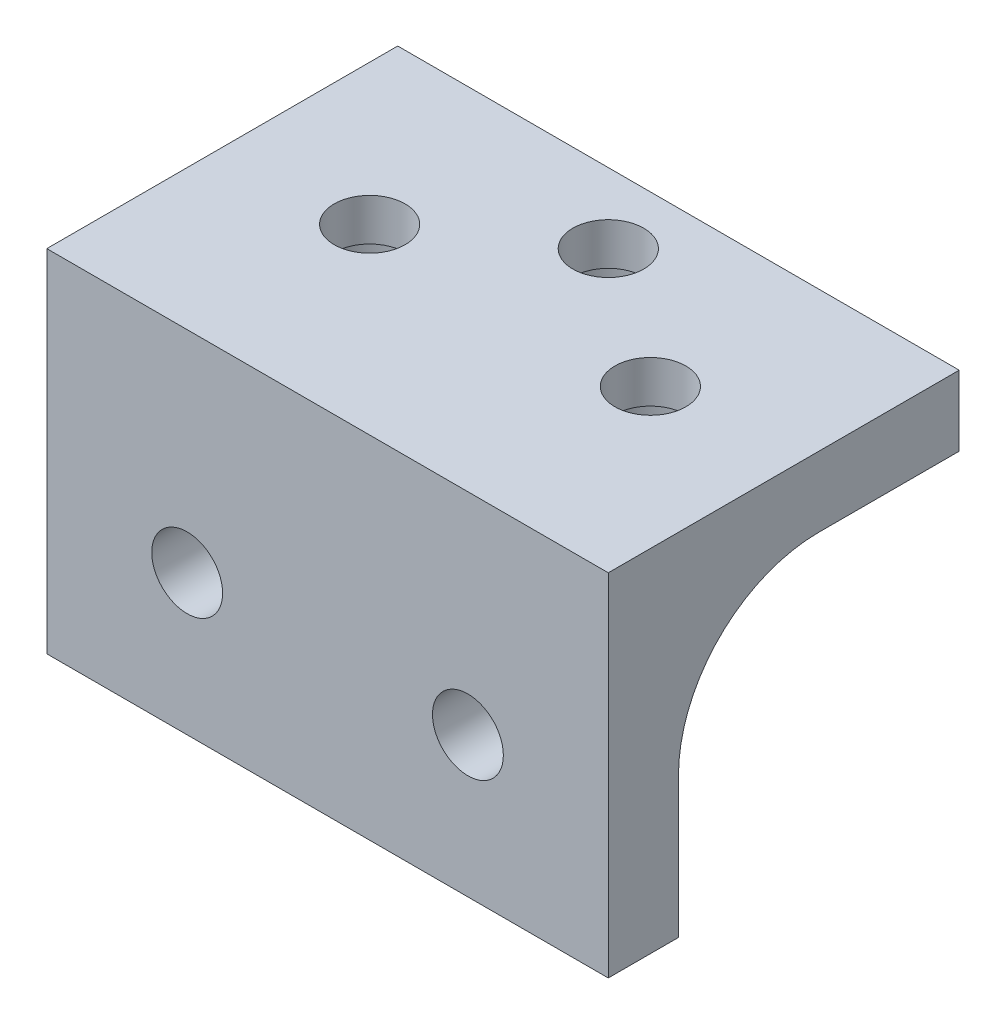
from build123d import *

# Parameters (mm, degrees)
CROQUIS1_W              = 40
CROQUIS1_H              = 20
CROQUIS1_R              = 2.525
CROQUIS1_H_2            = 5
SALIENTE_EXTRUIR1_DEPTH = 5
CROQUIS1_3_W            = 40
CROQUIS1_3_H            = 5
SALIENTE_EXTRUIR2_DEPTH = 20
CROQUIS2_R              = 2.525
CORTAR_EXTRUIR1_DEPTH   = 49.989794856
CROQUIS4_R              = 4.025
CORTAR_EXTRUIR2_DEPTH   = 2
REDONDEO1_R             = 10


with BuildPart() as part:
    # Croquis1 → Saliente-Extruir1 (new body)
    # profile 1 of 2: a face of its own
    with BuildSketch(Plane.XY):
        with Locations((20, 10)):
            Rectangle(CROQUIS1_W, CROQUIS1_H)
        with Locations((10, 10)):
            Circle(CROQUIS1_R, mode=Mode.SUBTRACT)
        with Locations((30, 10)):
            Circle(CROQUIS1_R, mode=Mode.SUBTRACT)
    # profile 2 of 2: a face of its own
    with BuildSketch(Plane.XY):
        with Locations((20, 22.5)):
            Rectangle(CROQUIS1_W, CROQUIS1_H_2)
    extrude(amount=SALIENTE_EXTRUIR1_DEPTH)

    # Croquis1<3> → Saliente-Extruir2 (add)
    with BuildSketch(Plane.XY):
        with Locations((20, 22.5)):
            Rectangle(CROQUIS1_3_W, CROQUIS1_3_H)
    extrude(amount=-SALIENTE_EXTRUIR2_DEPTH)

    # Croquis2 → Cortar-Extruir1 (cut, through all)
    with BuildSketch(Plane.XZ.offset(-20)):
        with Locations(Location((10, -8, 0), (0, 0, 270))):
            Circle(CROQUIS2_R)
        with Locations(Location((30, -8, 0), (0, 0, 270))):
            Circle(CROQUIS2_R)
        with Locations(Location((20, -15, 0), (0, 0, 270))):
            Circle(CROQUIS2_R)
    extrude(amount=-CORTAR_EXTRUIR1_DEPTH, mode=Mode.SUBTRACT)

    # Croquis4 → Cortar-Extruir2 (cut)
    with BuildSketch(Plane.XZ.offset(-20)):
        with Locations(Location((10, -8, 0), (0, 0, 270))):
            Circle(CROQUIS4_R)
        with Locations(Location((20, -15, 0), (0, 0, 270))):
            Circle(CROQUIS4_R)
        with Locations(Location((30, -8, 0), (0, 0, 270))):
            Circle(CROQUIS4_R)
    extrude(amount=-CORTAR_EXTRUIR2_DEPTH, mode=Mode.SUBTRACT)

    # Redondeo1
    # the kernel refuses this fillet: 10 mm, written as the material it adds along each edge
    with BuildSketch(Plane(origin=(0, 20, 0), x_dir=(0, -1, 0), z_dir=(1, 0, 0))) as redondeo1_piece_1_section:
        with BuildLine():
            CenterArc((REDONDEO1_R, REDONDEO1_R), REDONDEO1_R, 180, 90)
            Line((0, REDONDEO1_R), (0, 0))
            Line((0, 0), (REDONDEO1_R, 0))
        make_face()
    redondeo1_piece_1 = extrude(amount=40, mode=Mode.PRIVATE)
    redondeo1_piece_1 = redondeo1_piece_1 - Plane(origin=(10, 10, -2.034462618), x_dir=(1, 0, 0), z_dir=(0, 0, -1)) * Cylinder(2.525, 120, mode=Mode.PRIVATE)
    redondeo1_piece_1 = redondeo1_piece_1 - Plane(origin=(30, 10, -2.034462618), x_dir=(1, 0, 0), z_dir=(0, 0, -1)) * Cylinder(2.525, 120, mode=Mode.PRIVATE)
    redondeo1_piece_1 = redondeo1_piece_1 - Plane(origin=(10, 17.656034645, -8), x_dir=(0, 0, -1), z_dir=(0, -1, 0)) * Cylinder(4.025, 120, mode=Mode.PRIVATE)
    redondeo1_piece_1 = redondeo1_piece_1 - Plane(origin=(30, 17.656034645, -8), x_dir=(0, 0, -1), z_dir=(0, -1, 0)) * Cylinder(4.025, 120, mode=Mode.PRIVATE)
    add(redondeo1_piece_1)


solid = part.part
